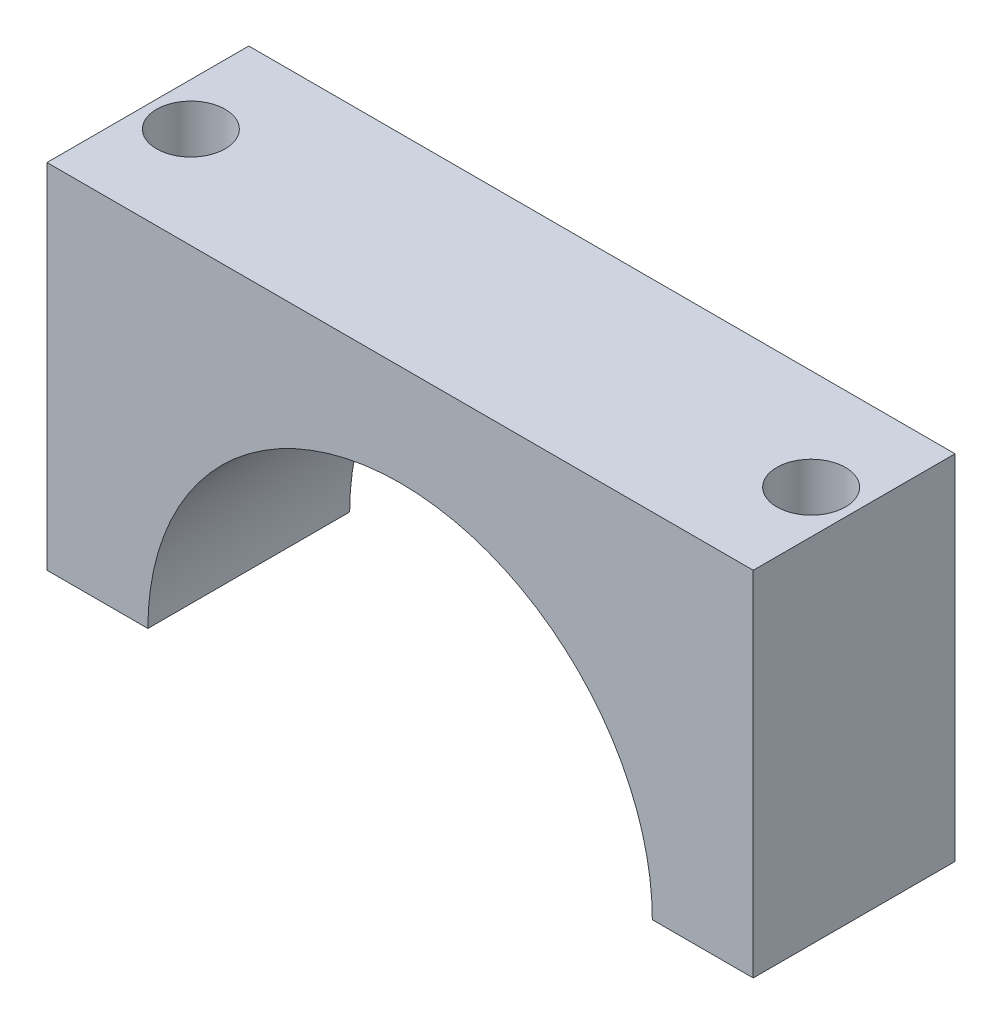
from build123d import *

# Parameters (mm, degrees)
BOSS_EXTRUDE1_DEPTH  = 10
M3_CLEARANCE_HOLE1_D = 3.4


with BuildPart() as part:
    # Sketch2 → Boss-Extrude1 (new body)
    with BuildSketch(Plane.XY):
        with BuildLine():
            Line((12.5, 0), (17.5, 0))
            Line((17.5, 0), (17.5, 17.5))
            Line((17.5, 17.5), (-17.5, 17.5))
            Line((-17.5, 17.5), (-17.5, 0))
            Line((-17.5, 0), (-12.5, 0))
            ThreePointArc((-12.5, 0), (0, 12.5), (12.5, 0))
        make_face()
    extrude(amount=BOSS_EXTRUDE1_DEPTH)

    # M3 Clearance Hole1 (through all)
    with Locations(Plane(origin=(0, 17.5, 0), x_dir=(1, 0, 0), z_dir=(0, 1, 0))):
        with Locations((-15.37, -5), (15.37, -5)):
            Hole(M3_CLEARANCE_HOLE1_D / 2)


solid = part.part
